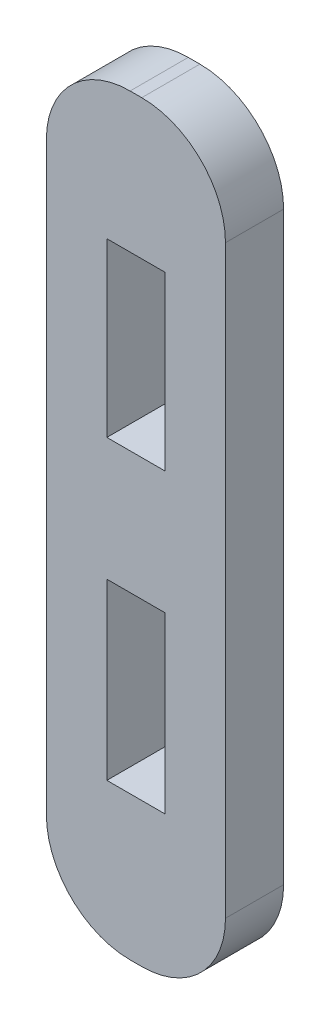
from build123d import *

# Parameters (mm, degrees)
SKETCH1_W           = 4.8895
SKETCH1_H           = 20.545164686
BOSS_EXTRUDE1_DEPTH = 1.5875
CUT_EXTRUDE1_DEPTH  = 22.178554211
FILLET1_R           = 2.286


with BuildPart() as part:
    # Sketch1 → Boss-Extrude1 (new body)
    with BuildSketch(Plane.XY):
        with Locations((2.44475, 10.272582343)):
            Rectangle(SKETCH1_W, SKETCH1_H)
    extrude(amount=BOSS_EXTRUDE1_DEPTH)

    # Sketch2 → Cut-Extrude1 (cut, through all)
    with BuildSketch(Plane(origin=(0, 0, 0), x_dir=(-1, 0, 0), z_dir=(0, 0, -1))):
        Polygon((-3.2385, 14.195164686), (-3.2385, 12.036164686), (-1.651, 12.036164686), (-1.651, 14.195164686), (-1.651, 15.35134982), (-1.651, 15.678624185), (-1.651, 16.735164686), (-3.2385, 16.735164686), (-3.2385, 15.678624185), (-3.2385, 15.35134982), align=None)
        Polygon((-1.651, 5.223268319), (-1.651, 6.407465023), (-1.651, 8.684230437), (-3.2385, 8.684230437), (-3.2385, 6.407465023), (-3.2385, 5.223268319), (-3.2385, 4.8665526), (-3.2385, 3.927777513), (-1.651, 3.927777513), (-1.651, 4.8665526), align=None)
    extrude(amount=-CUT_EXTRUDE1_DEPTH, mode=Mode.SUBTRACT)

    # Fillet1
    fillet1_edges = [part.edges().sort_by_distance(p)[0] for p in [
        (0, 0, 0.79375),
        (4.8895, 0, 0.79375),
        (4.8895, 20.545164686, 0.79375),
        (0, 20.545164686, 0.79375),
    ]]
    fillet(fillet1_edges, radius=FILLET1_R)


solid = part.part
